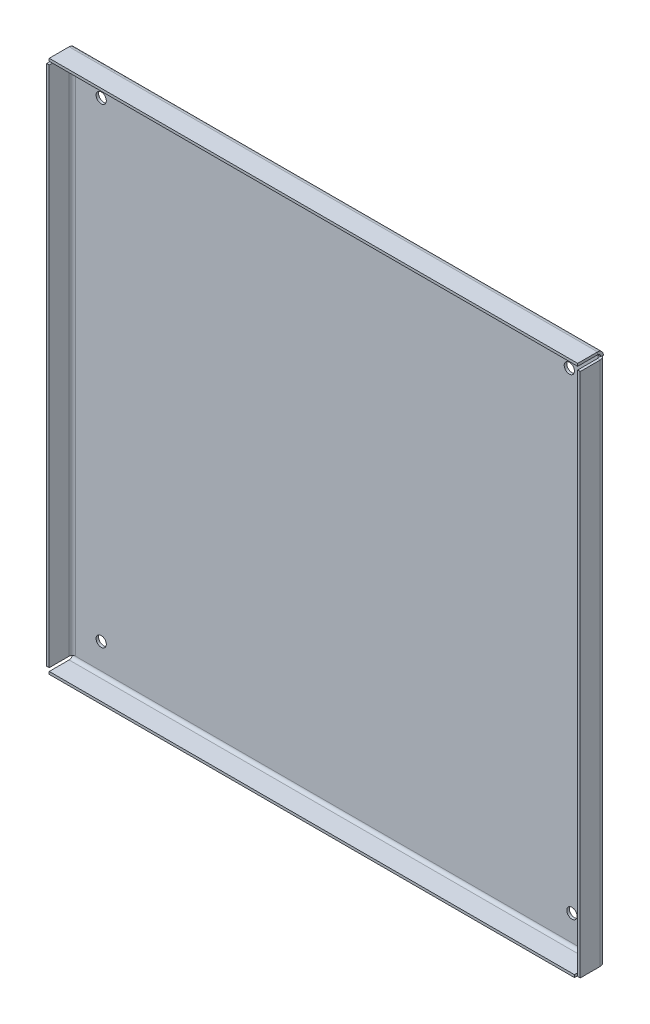
from build123d import *

# Parameters (mm, degrees)
SKETCH1_W                    = 412
SKETCH1_H                    = 412
BASE_FLANGE1_DEPTH           = 2
EDGE_FLANGE1_STRIP_W         = 13
EDGE_FLANGE1_STRIP_H         = 2
EDGE_FLANGE1_STRIP_CUT_DEPTH = 412
EDGE_FLANGE1_DEPTH           = 412
EDGE_FLANGE2_STRIP_W         = 13
EDGE_FLANGE2_STRIP_H         = 2
EDGE_FLANGE2_STRIP_CUT_DEPTH = 409.5
EDGE_FLANGE2_DEPTH           = 409.5
EDGE_FLANGE3_STRIP_W         = 13
EDGE_FLANGE3_STRIP_H         = 2
EDGE_FLANGE3_STRIP_CUT_DEPTH = 409.5
EDGE_FLANGE3_DEPTH           = 409.5
EDGE_FLANGE4_STRIP_W         = 13
EDGE_FLANGE4_STRIP_H         = 2
EDGE_FLANGE4_STRIP_CUT_DEPTH = 407
EDGE_FLANGE4_DEPTH           = 407
SKETCH18_R                   = 4
CUT_EXTRUDE1_DEPTH           = 10


# Sheet-metal steps are written as plain solids
with BuildPart() as part:
    # Sketch1 → Base-Flange1 (new body)
    with BuildSketch(Plane.XY):
        with Locations((1, -1)):
            Rectangle(SKETCH1_W, SKETCH1_H)
    extrude(amount=-BASE_FLANGE1_DEPTH)

    # Edge-Flange1 strip (across the edge) → Edge-Flange1 strip cut (cut)
    with BuildSketch(Plane(origin=(207, 205, 0), x_dir=(0, -1, 0), z_dir=(-1, 0, 0))):
        with Locations((-4, -1)):
            Rectangle(EDGE_FLANGE1_STRIP_W, EDGE_FLANGE1_STRIP_H)
    extrude(amount=EDGE_FLANGE1_STRIP_CUT_DEPTH, mode=Mode.SUBTRACT)

    # Edge-Flange1 section (across the edge) → Edge-Flange1 (add)
    with BuildSketch(Plane(origin=(207, 205, 0), x_dir=(0, -1, 0), z_dir=(-1, 0, 0))):
        with BuildLine():
            Line((-2, 2.5), (-2, 18))
            Line((-2, 18), (0, 18))
            Line((0, 18), (0, 2.5))
            ThreePointArc((0, 2.5), (0.732233047, 0.732233047), (2.5, 0))
            Line((2.5, 0), (2.5, -2))
            ThreePointArc((2.5, -2), (-0.681980515, -0.681980515), (-2, 2.5))
        make_face()
    extrude(amount=EDGE_FLANGE1_DEPTH)

    # Edge-Flange2 strip (across the edge) → Edge-Flange2 strip cut (cut)
    with BuildSketch(Plane(origin=(207, -207, 0), x_dir=(-1, 0, 0), z_dir=(0, 1, 0))):
        with Locations((-4, -1)):
            Rectangle(EDGE_FLANGE2_STRIP_W, EDGE_FLANGE2_STRIP_H)
    extrude(amount=EDGE_FLANGE2_STRIP_CUT_DEPTH, mode=Mode.SUBTRACT)

    # Edge-Flange2 section (across the edge) → Edge-Flange2 (add)
    with BuildSketch(Plane(origin=(207, -207, 0), x_dir=(-1, 0, 0), z_dir=(0, 1, 0))):
        with BuildLine():
            Line((-2, 2.5), (-2, 18))
            Line((-2, 18), (0, 18))
            Line((0, 18), (0, 2.5))
            ThreePointArc((0, 2.5), (0.732233047, 0.732233047), (2.5, 0))
            Line((2.5, 0), (2.5, -2))
            ThreePointArc((2.5, -2), (-0.681980515, -0.681980515), (-2, 2.5))
        make_face()
    extrude(amount=EDGE_FLANGE2_DEPTH)

    # Edge-Flange3 strip (across the edge) → Edge-Flange3 strip cut (cut)
    with BuildSketch(Plane(origin=(-205, -207, 0), x_dir=(0, 1, 0), z_dir=(1, 0, 0))):
        with Locations((-4, -1)):
            Rectangle(EDGE_FLANGE3_STRIP_W, EDGE_FLANGE3_STRIP_H)
    extrude(amount=EDGE_FLANGE3_STRIP_CUT_DEPTH, mode=Mode.SUBTRACT)

    # Edge-Flange3 section (across the edge) → Edge-Flange3 (add)
    with BuildSketch(Plane(origin=(-205, -207, 0), x_dir=(0, 1, 0), z_dir=(1, 0, 0))):
        with BuildLine():
            Line((-2, 2.5), (-2, 18))
            Line((-2, 18), (0, 18))
            Line((0, 18), (0, 2.5))
            ThreePointArc((0, 2.5), (0.732233047, 0.732233047), (2.5, 0))
            Line((2.5, 0), (2.5, -2))
            ThreePointArc((2.5, -2), (-0.681980515, -0.681980515), (-2, 2.5))
        make_face()
    extrude(amount=EDGE_FLANGE3_DEPTH)

    # Edge-Flange4 strip (across the edge) → Edge-Flange4 strip cut (cut)
    with BuildSketch(Plane(origin=(-205, 202.5, 0), x_dir=(1, 0, 0), z_dir=(0, -1, 0))):
        with Locations((-4, -1)):
            Rectangle(EDGE_FLANGE4_STRIP_W, EDGE_FLANGE4_STRIP_H)
    extrude(amount=EDGE_FLANGE4_STRIP_CUT_DEPTH, mode=Mode.SUBTRACT)

    # Edge-Flange4 section (across the edge) → Edge-Flange4 (add)
    with BuildSketch(Plane(origin=(-205, 202.5, 0), x_dir=(1, 0, 0), z_dir=(0, -1, 0))):
        with BuildLine():
            Line((-2, 2.5), (-2, 18))
            Line((-2, 18), (0, 18))
            Line((0, 18), (0, 2.5))
            ThreePointArc((0, 2.5), (0.732233047, 0.732233047), (2.5, 0))
            Line((2.5, 0), (2.5, -2))
            ThreePointArc((2.5, -2), (-0.681980515, -0.681980515), (-2, 2.5))
        make_face()
    extrude(amount=EDGE_FLANGE4_DEPTH)

    # Sketch18 → Cut-Extrude1 (cut)
    with BuildSketch(Plane(origin=(0, 0, -2), x_dir=(-1, 0, 0), z_dir=(0, 0, -1))):
        with Locations((-184.5, -184.5)):
            Circle(SKETCH18_R)
        with Locations((182.5, -184.5)):
            Circle(SKETCH18_R)
        with Locations((182.5, 182.5)):
            Circle(SKETCH18_R)
        with Locations((-182.5, 182.5)):
            Circle(SKETCH18_R)
    extrude(amount=-CUT_EXTRUDE1_DEPTH, mode=Mode.SUBTRACT)


solid = part.part
